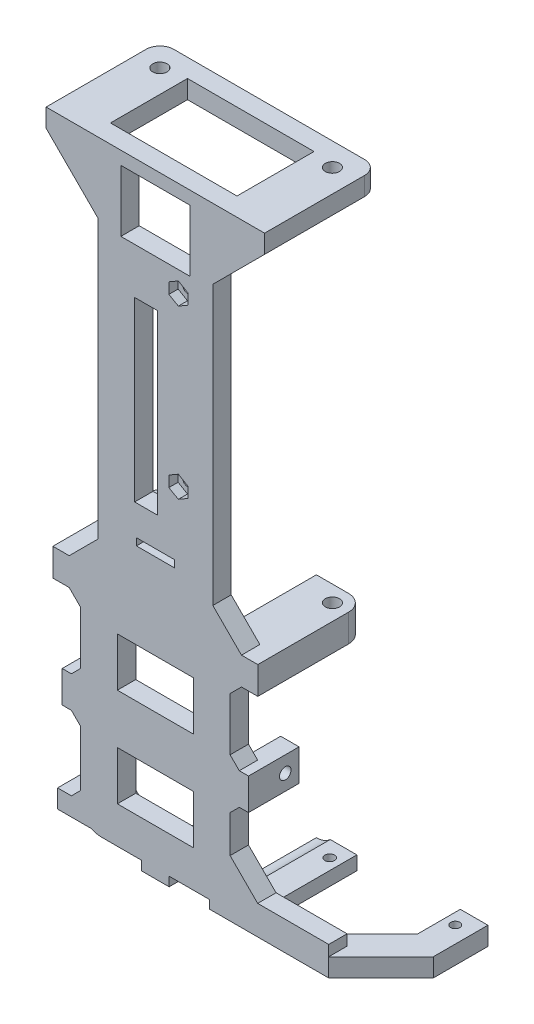
from build123d import *

# Parameters (mm, degrees)
EXTRUDE_1_DEPTH      = 4
SKETCH_2_W           = 15
SKETCH_2_H           = 13.3866
CUT_EXTRUDE_1_DEPTH  = 121.91505324
SKETCH_3_W           = 10
SKETCH_3_H           = 10
SKETCH_3_R           = 1.55
SKETCH_3_H_2         = 14.755
EXTRUDE_2_DEPTH      = 4
EXTRUDE_3_DEPTH      = 4
EXTRUDE_4_DEPTH      = 4
SKETCH_7_W           = 27.52
SKETCH_7_H           = 4
EXTRUDE_5_DEPTH      = 4
EXTRUDE_START        = -4
EXTRUDE_6_DEPTH      = 4
SKETCH_11_W          = 16.52
SKETCH_11_H          = 10.61
CUT_EXTRUDE_2_DEPTH  = 132.763875645
SKETCH_12_W          = 11
SKETCH_12_H          = 6.89
SKETCH_12_R          = 1.25
EXTRUDE_7525_DEPTH   = 4
SKETCH_14_R          = 1
CUT_EXTRUDE_3_DEPTH  = 132.071274218
SKETCH_15_R          = 0.9
EXTRUDE_9_DEPTH      = 1
FILLET_1_R           = 0.9
CUT_EXTRUDE_START    = -2
SKETCH_16_R          = 1
CUT_EXTRUDE_4_DEPTH  = 2
CUT_EXTRUDE_5_DEPTH  = 132.071274218
SKETCH_19_W          = 5
SKETCH_19_H          = 38.5268
SKETCH_19_W_2        = 8.236887868
SKETCH_19_H_2        = 1.55
CUT_EXTRUDE_6_DEPTH  = 132.071274218
EXTRUDE_12_DEPTH     = 23.28
CUT_EXTRUDE_7_REACH  = 99.794
SKETCH_23_R          = 1.55
EXTRUDE_13_DEPTH     = 4
CUT_EXTRUDE_START_2  = -19.28
CUT_EXTRUDE_8_DEPTH  = 19.48
SKETCH_26_W          = 10.1
SKETCH_26_H          = 2
EXTRUDE_14_DEPTH     = 3
EXTRUDE_15_DEPTH     = 19.255
CUT_EXTRUDE_9_REACH  = 145.584
SKETCH_28_R          = 1.05
EXTRUDE_START_2      = -11
EXTRUDE_16_DEPTH     = 11
SKETCH_30_R          = 1.25
CUT_EXTRUDE_10_DEPTH = 138.726600281
CHAMFER_1_SIZE       = 2
FILLET_2_R           = 3


# Read off the part's stored shape, not the designer's step: 切除-拉伸8
with BuildPart() as part:
    # 草图1 → 凸台-拉伸1 (new body)
    with BuildSketch(Plane.XY):
        with BuildLine():
            Line((-16.26, -7.25), (-16.26, 119.75))
            Line((-16.26, 119.75), (16.26, 119.75))
            Line((16.26, 119.75), (16.26, -7.25))
            ThreePointArc((16.26, -7.25), (14.939051583, -10.439051583), (11.75, -11.76))
            Line((11.75, -11.76), (-11.75, -11.76))
            ThreePointArc((-11.75, -11.76), (-14.939051583, -10.439051583), (-16.26, -7.25))
        make_face()
    extrude(amount=EXTRUDE_1_DEPTH)

    # 草图2 → 切除-拉伸1 (cut, through all)
    with BuildSketch(Plane(origin=(0, 0, 0), x_dir=(-1, 0, 0), z_dir=(0, 0, -1))):
        with Locations((0, 110.2067)):
            Rectangle(SKETCH_2_W, SKETCH_2_H)
    extrude(amount=-CUT_EXTRUDE_1_DEPTH, mode=Mode.SUBTRACT)

    # 草图3 → 凸台-拉伸2 (add)
    # profile 1 of 2: a face of its own
    with BuildSketch(Plane(origin=(0, 119.75, 0), x_dir=(1, 0, 0), z_dir=(0, 1, 0))):
        with Locations((-18.76, 15.755)):
            Rectangle(SKETCH_3_W, SKETCH_3_H)
        with Locations(Location((-18.76, 15.755, 0), (0, 0, 270))):
            Circle(SKETCH_3_R, mode=Mode.SUBTRACT)
    # profile 2 of 2: a face of its own
    with BuildSketch(Plane(origin=(0, 119.75, 0), x_dir=(1, 0, 0), z_dir=(0, 1, 0))):
        with Locations((-18.76, 3.3775)):
            Rectangle(SKETCH_3_W, SKETCH_3_H_2)
    extrude_2 = extrude(amount=-EXTRUDE_2_DEPTH)

    # 镜向1: 凸台-拉伸2 across plane
    add(extrude_2.mirror(Plane(origin=(0, 0, 0), x_dir=(0, 0, 1), z_dir=(1, 0, 0))))

    # 草图6 → 凸台-拉伸4 (add)
    with BuildSketch(Plane.XY.offset(4)):
        Polygon((-16.26, 115.75), (-23.76, 115.75), (-16.26, 108.25), align=None)
        Polygon((16.26, 115.75), (16.26, 108.25), (23.76, 115.75), align=None)
    extrude(amount=-EXTRUDE_4_DEPTH)

    # 草图7 → 凸台-拉伸5 (add)
    with BuildSketch(Plane(origin=(0, 119.75, 0), x_dir=(1, 0, 0), z_dir=(0, 1, 0))):
        with Locations((0, 18.755)):
            Rectangle(SKETCH_7_W, SKETCH_7_H)
    extrude(amount=-EXTRUDE_5_DEPTH)



with BuildPart() as body_2:
    # 草图5 → 凸台-拉伸3 (new body)
    with BuildSketch(Plane(origin=(0, -13.58, 0), x_dir=(1, 0, 0), z_dir=(0, 1, 0))):
        Polygon((47.78, 9.855), (43.08, 9.855), (29.225, -4), (37.710281374, -4), (49.08, 7.369718626), (49.08, 9.855), align=None)
        with BuildLine():
            Line((47.78, 19.255), (43.08, 19.255))
            Line((43.08, 19.255), (43.08, 9.855))
            Line((43.08, 9.855), (47.78, 9.855))
            Line((47.78, 9.855), (47.78, 15.105))
            Line((47.78, 15.105), (46.239934208, 15.105))
            ThreePointArc((46.239934208, 15.105), (44.48, 15.755), (46.239934208, 16.405))
            Line((46.239934208, 16.405), (47.78, 16.405))
            Line((47.78, 16.405), (47.78, 19.255))
        make_face()
        with BuildLine():
            Line((49.08, 19.255), (47.78, 19.255))
            Line((47.78, 19.255), (47.78, 16.405))
            Line((47.78, 16.405), (46.239934208, 16.405))
            ThreePointArc((46.239934208, 16.405), (46.418065618, 16.10145764), (46.48, 15.755))
            ThreePointArc((46.48, 15.755), (46.418065618, 15.40854236), (46.239934208, 15.105))
            Line((46.239934208, 15.105), (47.78, 15.105))
            Line((47.78, 15.105), (47.78, 9.855))
            Line((47.78, 9.855), (49.08, 9.855))
            Line((49.08, 9.855), (49.08, 19.255))
        make_face()
    extrude(amount=EXTRUDE_3_DEPTH)


with BuildPart() as part_1:
    add(part.part)

    add(body_2.part)  # 凸台-拉伸6 merges body 2
    # 草图8 → 凸台-拉伸6 (add)
    with BuildSketch(Plane.XY.offset(4).offset(EXTRUDE_START)):
        with BuildLine():
            Line((22.26, -7.25), (16.26, -7.25))
            ThreePointArc((16.26, -7.25), (14.939051583, -10.439051583), (11.75, -11.76))
            Line((11.75, -11.76), (11.75, -13.58))
            Line((11.75, -13.58), (37.710281374, -13.58))
            Line((37.710281374, -13.58), (37.710281374, -7.25))
            Line((37.710281374, -7.25), (22.26, -7.25))
        make_face()
        with BuildLine():
            Line((16.26, -7.25), (11.75, -7.25))
            Line((11.75, -7.25), (11.75, -11.76))
            ThreePointArc((11.75, -11.76), (14.939051583, -10.439051583), (16.26, -7.25))
        make_face()
        Polygon((11.75, 3.26), (11.75, -7.25), (16.26, -7.25), (16.26, -1.25), align=None)
        Polygon((16.26, -1.25), (16.26, -7.25), (22.26, -7.25), align=None)
    extrude(amount=EXTRUDE_6_DEPTH)

    # 草图11 → 切除-拉伸2 (cut, through all)
    with BuildSketch(Plane.XY.offset(4)):
        with Locations((0, 1.545)):
            Rectangle(SKETCH_11_W, SKETCH_11_H)
        with Locations((0, 22.955)):
            Rectangle(SKETCH_11_W, SKETCH_11_H)
    extrude(amount=-CUT_EXTRUDE_2_DEPTH, mode=Mode.SUBTRACT)

    # 草图12 → Extrude 7525 (add)
    with BuildSketch(Plane.ZY.offset(16.26)):
        with Locations((-1.5, 12.295)):
            Rectangle(SKETCH_12_W, SKETCH_12_H)
        with Locations(Location((-4, 12.25, 0), (0, 0, 270))):
            Circle(SKETCH_12_R, mode=Mode.SUBTRACT)
    extrude_7525 = extrude(amount=EXTRUDE_7525_DEPTH)

    # 镜向4: Extrude 7525 across plane
    add(extrude_7525.mirror(Plane(origin=(0, 0, 0), x_dir=(0, 0, 1), z_dir=(1, 0, 0))))

    # 草图14 → 切除-拉伸3 (cut, through all)
    with BuildSketch(Plane(origin=(0, 0, 0), x_dir=(-1, 0, 0), z_dir=(0, 0, -1))):
        with Locations((-5, 62.6)):
            Circle(SKETCH_14_R)
        with Locations((-5, 99)):
            Circle(SKETCH_14_R)
    extrude(amount=-CUT_EXTRUDE_3_DEPTH, mode=Mode.SUBTRACT)

    # 草图15 → 凸台-拉伸9 (add)
    with BuildSketch(Plane(origin=(0, 0, 0), x_dir=(-1, 0, 0), z_dir=(0, 0, -1))):
        with Locations(Location((-5, 94.35, 0), (0, 0, 180))):
            Circle(SKETCH_15_R)
        with Locations(Location((-5, 57.98, 0), (0, 0, 180))):
            Circle(SKETCH_15_R)
    extrude(amount=EXTRUDE_9_DEPTH)

    # 圆角1
    fillet_1_edges = [part_1.edges().sort_by_distance(p)[0] for p in [
        (4.1, 94.35, -1),
        (4.1, 57.98, -1),
    ]]
    fillet(fillet_1_edges, radius=FILLET_1_R)

    # 草图16 → 切除-拉伸4 (cut)
    # profile 1 of 2: a face of its own
    with BuildSketch(Plane.XY.offset(4).offset(CUT_EXTRUDE_START)):
        Polygon((7.05, 61.416431948), (7.05, 63.783568052), (5, 64.967136104), (2.95, 63.783568052), (2.95, 61.416431948), (5, 60.232863896), align=None)
        with Locations(Location((5, 62.6, 0), (0, 0, 180))):
            Circle(SKETCH_16_R, mode=Mode.SUBTRACT)
    # profile 2 of 2: a face of its own
    with BuildSketch(Plane.XY.offset(4).offset(CUT_EXTRUDE_START)):
        Polygon((2.95, 97.816431948), (5, 96.632863896), (7.05, 97.816431948), (7.05, 100.183568052), (5, 101.367136104), (2.95, 100.183568052), align=None)
        with Locations(Location((5, 99, 0), (0, 0, 180))):
            Circle(SKETCH_16_R, mode=Mode.SUBTRACT)
    extrude(amount=CUT_EXTRUDE_4_DEPTH, mode=Mode.SUBTRACT)

    # 草图17 → 切除-拉伸5 (cut, symmetric)
    with BuildSketch(Plane(origin=(0, 0, 0), x_dir=(-1, 0, 0), z_dir=(0, 0, -1))):
        Polygon((-12.5, 104.49), (-16.26, 108.25), (-16.26, 40.2266), (-12.5, 43.9866), align=None)
    cut_extrude_5 = extrude(amount=CUT_EXTRUDE_5_DEPTH, both=True, mode=Mode.SUBTRACT)

    # 镜向2: 切除-拉伸5 across plane
    add(cut_extrude_5.mirror(Plane(origin=(0, 0, 0), x_dir=(0, 0, 1), z_dir=(1, 0, 0))), mode=Mode.SUBTRACT)

    # 草图19 → 切除-拉伸6 (cut, through all)
    with BuildSketch(Plane(origin=(0, 0, 0), x_dir=(-1, 0, 0), z_dir=(0, 0, -1))):
        with Locations((2, 74.25)):
            Rectangle(SKETCH_19_W, SKETCH_19_H)
        with Locations((0, 47.675)):
            Rectangle(SKETCH_19_W_2, SKETCH_19_H_2)
    extrude(amount=-CUT_EXTRUDE_6_DEPTH, mode=Mode.SUBTRACT)

    # 草图22 → 凸台-拉伸12 (add)
    with BuildSketch(Plane.XY.offset(4)):
        with BuildLine():
            Line((16.26, 32.704986911), (16.26, 31.75))
            Line((16.26, 31.75), (22.285, 31.75))
            Line((22.285, 31.75), (22.285, 37.75))
            Line((22.285, 37.75), (11.75, 37.75))
            Line((11.75, 37.75), (11.75, 36.36))
            ThreePointArc((11.75, 36.36), (14.652551493, 35.331521301), (16.26, 32.704986911))
        make_face()
    extrude_12 = extrude(amount=-EXTRUDE_12_DEPTH)

    # 草图23 → 切除-拉伸7 (cut, up to next)
    with BuildSketch(Plane(origin=(0, 37.75, 0), x_dir=(1, 0, 0), z_dir=(0, 1, 0)), mode=Mode.PRIVATE) as cut_extrude_7_sk1:
        with Locations(Location((18.76, 15.755, 0), (0, 0, 270))):
            Circle(SKETCH_23_R)
    cut_extrude_7_tool1 = extrude(cut_extrude_7_sk1.sketch, amount=-CUT_EXTRUDE_7_REACH, mode=Mode.PRIVATE) & part_1.part
    # 草图23 → 切除-拉伸7 (cut, up to next)
    with BuildSketch(Plane(origin=(0, 37.75, 0), x_dir=(1, 0, 0), z_dir=(0, 1, 0)), mode=Mode.PRIVATE) as cut_extrude_7_sk2:
        with BuildLine():
            ThreePointArc((18.76, 19.28), (21.252551404, 18.247551404), (22.285, 15.755))
            Line((22.285, 15.755), (22.285, 19.28))
            Line((22.285, 19.28), (18.76, 19.28))
        make_face()
    cut_extrude_7_tool2 = extrude(cut_extrude_7_sk2.sketch, amount=-CUT_EXTRUDE_7_REACH, mode=Mode.PRIVATE) & part_1.part
    cut_extrude_7_1 = cut_extrude_7_tool1.solids().sort_by_distance((18.76, 37.75, -15.755))[0]
    add(cut_extrude_7_1, mode=Mode.SUBTRACT)
    cut_extrude_7_2 = cut_extrude_7_tool2.solids().sort_by_distance((21.497628, 37.75, -18.492628))[0]
    add(cut_extrude_7_2, mode=Mode.SUBTRACT)
    cut_extrude_7 = cut_extrude_7_1 + cut_extrude_7_2  # 切除-拉伸7 as one shape, for the pattern or mirror that repeats it

    # 草图24 → 凸台-拉伸13 (add)
    with BuildSketch(Plane.XY.offset(4)):
        Polygon((16.26, 40.2266), (18.7366, 37.75), (18.7366, 31.75), (16.26, 29.2734), align=None)
    extrude_13 = extrude(amount=-EXTRUDE_13_DEPTH)

    # 镜向3: 凸台-拉伸12, 切除-拉伸7, 凸台-拉伸13 across plane
    add(extrude_12.mirror(Plane(origin=(0, 0, 0), x_dir=(0, 0, 1), z_dir=(1, 0, 0))))
    add(cut_extrude_7.mirror(Plane(origin=(0, 0, 0), x_dir=(0, 0, 1), z_dir=(1, 0, 0))), mode=Mode.SUBTRACT)
    add(extrude_13.mirror(Plane(origin=(0, 0, 0), x_dir=(0, 0, 1), z_dir=(1, 0, 0))))

    # 切除-拉伸8 outline → 切除-拉伸8 (cut)
    with BuildSketch(Plane.XY.offset(CUT_EXTRUDE_START_2)):
        with BuildLine():
            ThreePointArc((-16.26, 31.75), (-16.176051621, 32.616121846), (-15.927331684, 33.45))
            Line((-15.927331684, 33.45), (-22.285, 33.45))
            Line((-22.285, 33.45), (-22.285, 31.75))
            Line((-22.285, 31.75), (-16.26, 31.75))
        make_face()
    extrude(amount=CUT_EXTRUDE_8_DEPTH, mode=Mode.SUBTRACT)

    # 草图26 → 凸台-拉伸14 (add, symmetric)
    with BuildSketch(Plane(origin=(0, 0, 0), x_dir=(0, 0, -1), z_dir=(1, 0, 0))):
        with Locations((1.05, -12.76)):
            Rectangle(SKETCH_26_W, SKETCH_26_H)
        Polygon((8.1, -11.76), (8.1, -13.76), (6.1, -13.76), (6.1, -11.76), (6.1, -10.76), (7.1, -10.76), align=None)
    extrude(amount=EXTRUDE_14_DEPTH, both=True)

    # 草图27 → 凸台-拉伸15 (add)
    with BuildSketch(Plane(origin=(0, 0, 0), x_dir=(-1, 0, 0), z_dir=(0, 0, -1))):
        with BuildLine():
            Line((-11.75, -11.76), (-11.75, -13.58))
            Line((-11.75, -13.58), (-20.58, -13.58))
            Line((-20.58, -13.58), (-20.58, -10.58))
            Line((-20.58, -10.58), (-14.791578538, -10.58))
            ThreePointArc((-14.791578538, -10.58), (-13.381226532, -11.454664077), (-11.75, -11.76))
        make_face()
    extrude(amount=EXTRUDE_15_DEPTH)

    # 草图28 → 切除-拉伸9 (cut, up to next)
    with BuildSketch(Plane.XZ.offset(13.58), mode=Mode.PRIVATE) as cut_extrude_9_sk1:
        with Locations((18.18, -15.755)):
            Circle(SKETCH_28_R)
    cut_extrude_9_tool1 = extrude(cut_extrude_9_sk1.sketch, amount=-CUT_EXTRUDE_9_REACH, mode=Mode.PRIVATE) & part_1.part
    add(cut_extrude_9_tool1.solids().sort_by_distance((18.18, -13.58, -15.755))[0], mode=Mode.SUBTRACT)

    # 草图29 → 凸台-拉伸16 (add)
    with BuildSketch(Plane.XY.offset(4).offset(EXTRUDE_START_2)):
        with BuildLine():
            Line((-21.26, -7.25), (-21.26, -11.25))
            Line((-21.26, -11.25), (-13.833290666, -11.25))
            ThreePointArc((-13.833290666, -11.25), (-15.605887764, -9.589279707), (-16.26, -7.25))
            Line((-16.26, -7.25), (-21.26, -7.25))
        make_face()
    extrude(amount=EXTRUDE_16_DEPTH)

    # 草图30 → 切除-拉伸10 (cut, through all)
    with BuildSketch(Plane(origin=(0, -7.25, 0), x_dir=(1, 0, 0), z_dir=(0, 1, 0))):
        with Locations(Location((-17.76, 3.5, 0), (0, 0, 180))):
            Circle(SKETCH_30_R)
    extrude(amount=-CUT_EXTRUDE_10_DEPTH, mode=Mode.SUBTRACT)

    # 倒角1
    chamfer_1_edges = [part_1.edges().sort_by_distance(p)[0] for p in [
        (-16.26, 8.85, 2),
        (-16.26, 15.74, 2),
        (16.26, 8.85, 2),
        (16.26, 15.74, 2),
        (-16.26, -7.25, 2),
    ]]
    chamfer(chamfer_1_edges, length=CHAMFER_1_SIZE)

    # 圆角2
    fillet_2_edges = [part_1.edges().sort_by_distance(p)[0] for p in [
        (-23.76, 117.75, -20.755),
        (23.76, 117.75, -20.755),
    ]]
    fillet(fillet_2_edges, radius=FILLET_2_R)


solid = part_1.part
